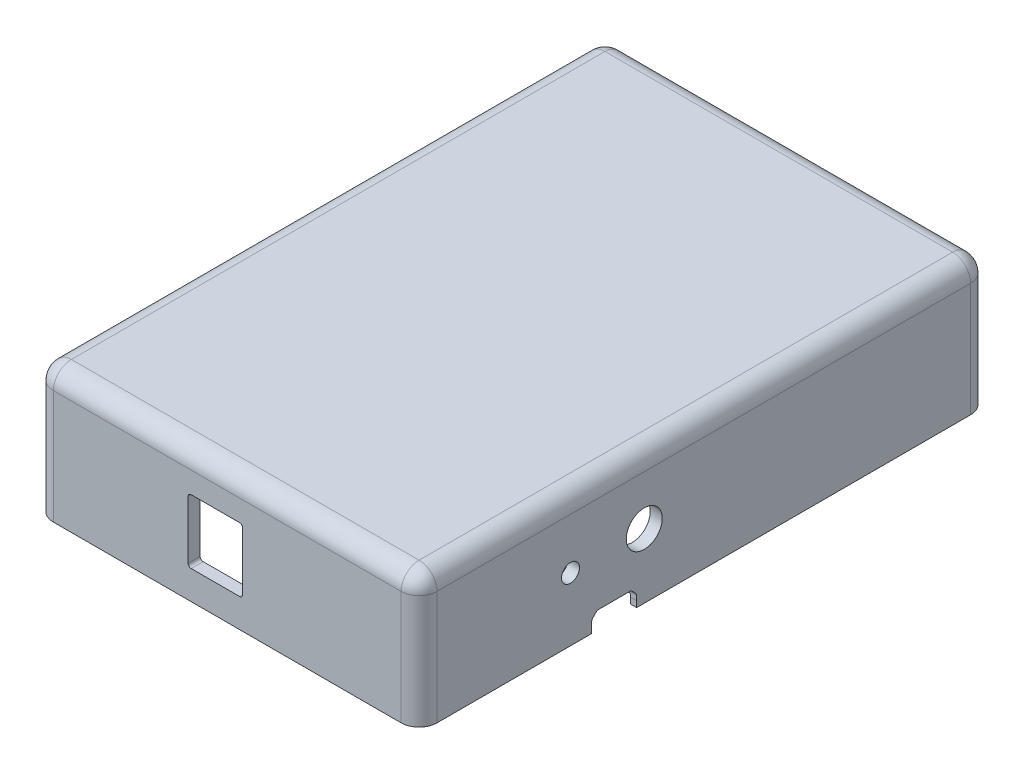
from build123d import *

# Parameters (mm, degrees)
SKETCH1_W            = 64
SKETCH1_H            = 95
BOSS_EXTRUDE1_DEPTH  = 2
BOSS_EXTRUDE2_DEPTH  = 20
CUT_EXTRUDE1_DEPTH   = 1.5
FILLET1_R            = 10
CUT_EXTRUDE5_REACH   = 104.22
SKETCH11_R           = 4
BOSS_EXTRUDE4_DEPTH  = 20
SKETCH15_W           = 35.50000000000001
SKETCH15_H           = 3.499999999999986
BOSS_EXTRUDE5_DEPTH  = 11
CUT_EXTRUDE6_DEPTH   = 9
CHAMFER4_SIZE        = 4.2
SKETCH18_R           = 4.999999999999999
SKETCH18_R_2         = 1.5000000000000009
BOSS_EXTRUDE6_DEPTH  = 18.5
FILLET2_R            = 3
FILLET3_R            = 3
SKETCH20_W           = 3.0000000000000036
SKETCH20_H           = 2.4299999999999855
SKETCH20_W_2         = 2.9999999999999964
SKETCH20_H_2         = 2.4299999999999926
BOSS_EXTRUDE7_DEPTH  = 18.5
FILLET6_R            = 1
FILLET7_R            = 2
SKETCH21_R           = 3.2500000000003135
SKETCH21_R_2         = 1.5000000000003137
BOSS_EXTRUDE8_DEPTH  = 3
LPATTERN1_COUNT      = 2
LPATTERN1_PITCH      = 52
SKETCH22_R           = 2.499999999999491
SKETCH22_R_2         = 0.9999999999994937
BOSS_EXTRUDE9_DEPTH  = 3
CUT_EXTRUDE11_DEPTH  = 7
LPATTERN3_COUNT      = 2
LPATTERN3_PITCH      = 41
CUT_EXTRUDE15_DEPTH  = 6.999999999999994
CUT_EXTRUDE16_DEPTH  = 2
SKETCH28_W           = 1.0000000000000036
SKETCH28_H           = 7.499999999999988
CUT_EXTRUDE17_DEPTH  = 1
SKETCH29_R           = 1.5000000000071216
CUT_EXTRUDE18_DEPTH  = 3
SKETCH30_R           = 3.0000000000000013
CUT_EXTRUDE19_DEPTH  = 3
CUT_EXTRUDE21_DEPTH  = 3
FILLET8_R            = 5
FILLET9_R            = 0.5
SKETCH34_R           = 1.500000000000316
BOSS_EXTRUDE10_DEPTH = 7
LPATTERN4_COUNT      = 2
LPATTERN4_PITCH      = 52
SKETCH35_R           = 0.9999999999994945
BOSS_EXTRUDE11_DEPTH = 5
LPATTERN5_COUNT      = 2
LPATTERN5_PITCH      = 41


with BuildPart() as part:
    # Sketch1 → Boss-Extrude1 (new body)
    with BuildSketch(Plane(origin=(0, 0, 0), x_dir=(1, 0, 0), z_dir=(0, 1, 0))):
        Rectangle(SKETCH1_W, SKETCH1_H)
    extrude(amount=BOSS_EXTRUDE1_DEPTH)

    # 3DSketch3 → Boss-Extrude2 (add)
    with BuildSketch(Plane(origin=(-29.999999999999986, 0, 45.49999999999999), x_dir=(0.554700196225229, 0, -0.8320502943378437), z_dir=(0, 1, 0))):
        Polygon((-2.7735009811261575, 0.5547001962252318), (76.27127698096902, 53.251218837622), (111.77208953938367, 0), (32.727311577288496, -52.69651864139676), align=None)
        Polygon((0, 0), (75.71657678474375, 50.47771785649584), (108.9985885582575, 0.554700196225201), (33.28201177351374, -49.923017660270624), align=None, mode=Mode.SUBTRACT)
    extrude(amount=-BOSS_EXTRUDE2_DEPTH)

    # Sketch2 → Cut-Extrude1 (cut)
    with BuildSketch(Plane.XZ.offset(20)):
        Polygon((31, 46.50000000000001), (-30.999999999999993, 46.50000000000001), (-30.999999999999993, -46.50000000000001), (31.000000000000007, -46.50000000000001), align=None)
    extrude(amount=-CUT_EXTRUDE1_DEPTH, mode=Mode.SUBTRACT)

    # Fillet1
    fillet1_edges = [part.edges().sort_by_distance(p)[0] for p in [
        (30.000000000000014, -9.25, -45.49999999999998),
        (-30, -9.25, -45.49999999999998),
        (30.000000000000007, -9.25, 45.5),
        (-29.999999999999986, -9.25, 45.49999999999999),
    ]]
    fillet(fillet1_edges, radius=FILLET1_R)

    # Sketch11 → Cut-Extrude5 (cut, up to next)
    with BuildSketch(Plane(origin=(0, 0, -47.5), x_dir=(-1, 0, 0), z_dir=(0, 0, -1)), mode=Mode.PRIVATE) as cut_extrude5_sk1:
        with Locations((-6.94e-15, -20)):
            Circle(SKETCH11_R)
    cut_extrude5_tool1 = extrude(cut_extrude5_sk1.sketch, amount=-CUT_EXTRUDE5_REACH, mode=Mode.PRIVATE) & part.part
    add(cut_extrude5_tool1.solids().sort_by_distance((0, -20, -47.5))[0], mode=Mode.SUBTRACT)

    # Sketch13 → Boss-Extrude4 (add)
    with BuildSketch(Plane.XZ):
        Polygon((15.250000000000018, -43.06999999999999), (-25.249999999999986, -43.07), (-25.249999999999986, -34.56999999999999), (15.250000000000018, -34.56999999999999), align=None)
        Polygon((12.750000000000016, -40.569999999999986), (12.750000000000016, -37.06999999999999), (-22.74999999999999, -37.07), (-22.74999999999999, -40.569999999999986), align=None, mode=Mode.SUBTRACT)
    extrude(amount=BOSS_EXTRUDE4_DEPTH)

    # Sketch15 → Boss-Extrude5 (add)
    with BuildSketch(Plane.XZ):
        with Locations((-4.999999999999987, -38.81999999999999)):
            Rectangle(SKETCH15_W, SKETCH15_H)
    extrude(amount=BOSS_EXTRUDE5_DEPTH)

    # Sketch17 → Cut-Extrude6 (cut)
    with BuildSketch(Plane.XY.offset(-34.56999999999999)):
        Polygon((4.7500000000000115, -20), (-15.24999999999999, -20.000000000000004), (-15.24999999999999, -15.5), (4.7500000000000115, -15.5), align=None)
    extrude(amount=-CUT_EXTRUDE6_DEPTH, mode=Mode.SUBTRACT)

    # Chamfer4
    chamfer4_edges = [part.edges().sort_by_distance(p)[0] for p in [
        (-15.249999999999984, -20.000000000000004, -35.81999999999999),
    ]]
    chamfer(chamfer4_edges, length=CHAMFER4_SIZE)

    # Sketch18 → Boss-Extrude6 (add)
    # profile 1 of 2: a face of its own
    with BuildSketch(Plane.XZ):
        with Locations((25.65752160816483, -41.15752160816483)):
            Circle(SKETCH18_R)
        with Locations(Location((25.65752160816483, -41.15752160816483, 0), (0, 0, 270))):
            Circle(SKETCH18_R_2, mode=Mode.SUBTRACT)
    # profile 2 of 2: a face of its own
    with BuildSketch(Plane.XZ):
        with Locations((-25.657521608164807, 41.15752160816483)):
            Circle(SKETCH18_R)
        with Locations(Location((-25.657521608164807, 41.15752160816483, 0), (0, 0, 270))):
            Circle(SKETCH18_R_2, mode=Mode.SUBTRACT)
    extrude(amount=BOSS_EXTRUDE6_DEPTH)

    # Fillet2
    fillet2_edges = [part.edges().sort_by_distance(p)[0] for p in [
        (32, -9, 47.5),
        (-31.999999999999993, -9, 47.5),
        (-31.999999999999993, -9, -47.500000000000014),
        (32.00000000000001, -9, -47.5),
    ]]
    fillet(fillet2_edges, radius=FILLET2_R)

    # Fillet3
    fillet3_edges = [part.edges().sort_by_distance(p)[0] for p in [
        (32.00000000000001, 2, 0),
        (1.421e-14, 2, 47.5),
        (7.11e-15, 2, -47.5),
        (-31.999999999999993, 2, 0),
        (31.121320343559645, 2.000000000000001, -46.62132034355964),
        (-31.121320343559635, 2.000000000000002, -46.621320343559645),
        (-31.121320343559635, 2, 46.621320343559645),
        (31.121320343559663, 1.9999999999999987, 46.621320343559645),
    ]]
    fillet(fillet3_edges, radius=FILLET3_R)

    # Sketch20 → Boss-Extrude7 (add)
    with BuildSketch(Plane.XZ):
        with Locations((11.500000000000018, -44.285)):
            Rectangle(SKETCH20_W, SKETCH20_H)
        with Locations((-18.749999999999986, -44.285)):
            Rectangle(SKETCH20_W_2, SKETCH20_H_2)
    extrude(amount=BOSS_EXTRUDE7_DEPTH)

    # Fillet6
    fillet6_edges = [part.edges().sort_by_distance(p)[0] for p in [
        (10.000000000000016, -9.25, -43.07),
        (13.000000000000018, -9.25, -43.07),
        (-20.249999999999982, -9.25, -43.07),
        (-17.249999999999986, -9.25, -43.07),
    ]]
    fillet(fillet6_edges, radius=FILLET6_R)

    # Fillet7
    # the kernel refuses this fillet: 2 mm, written as the material it adds along each edge
    with BuildSketch(Plane(origin=(15.250000000000018, 0, -34.56999999999999), x_dir=(1, 0, 0), z_dir=(0, 0, -1))) as fillet7_piece_1:
        with BuildLine():
            CenterArc((FILLET7_R, FILLET7_R), FILLET7_R, 180, 90)
            Line((0, FILLET7_R), (-FILLET7_R * 0.02, FILLET7_R))
            Line((-FILLET7_R * 0.02, FILLET7_R), (-FILLET7_R * 0.02, -FILLET7_R * 0.02))
            Line((-FILLET7_R * 0.02, -FILLET7_R * 0.02), (FILLET7_R, -FILLET7_R * 0.02))
            Line((FILLET7_R, -FILLET7_R * 0.02), (FILLET7_R, 0))
        make_face()
    extrude(amount=8.5)
    with BuildSketch(Plane(origin=(-25.249999999999986, 0, -34.56999999999999), x_dir=(0, 0, 1), z_dir=(1, 0, 0))) as fillet7_piece_2:
        with BuildLine():
            CenterArc((FILLET7_R, FILLET7_R), FILLET7_R, 180, 90)
            Line((0, FILLET7_R), (-FILLET7_R * 0.02, FILLET7_R))
            Line((-FILLET7_R * 0.02, FILLET7_R), (-FILLET7_R * 0.02, -FILLET7_R * 0.02))
            Line((-FILLET7_R * 0.02, -FILLET7_R * 0.02), (FILLET7_R, -FILLET7_R * 0.02))
            Line((FILLET7_R, -FILLET7_R * 0.02), (FILLET7_R, 0))
        make_face()
    extrude(amount=40.5)
    with BuildSketch(Plane(origin=(-25.249999999999986, 0, -43.07), x_dir=(-1, 0, 0), z_dir=(0, 0, 1))) as fillet7_piece_3:
        with BuildLine():
            CenterArc((FILLET7_R, FILLET7_R), FILLET7_R, 180, 90)
            Line((0, FILLET7_R), (-FILLET7_R * 0.02, FILLET7_R))
            Line((-FILLET7_R * 0.02, FILLET7_R), (-FILLET7_R * 0.02, -FILLET7_R * 0.02))
            Line((-FILLET7_R * 0.02, -FILLET7_R * 0.02), (FILLET7_R, -FILLET7_R * 0.02))
            Line((FILLET7_R, -FILLET7_R * 0.02), (FILLET7_R, 0))
        make_face()
    extrude(amount=8.500000000000007)
    with BuildSketch(Plane(origin=(-25.249999999999986, 0, -34.56999999999999), x_dir=(0, 0, 1), z_dir=(1, 0, 0))) as fillet7_piece_4a_section:
        with BuildLine():
            CenterArc((FILLET7_R, FILLET7_R), FILLET7_R, 180, 90)
            Line((0, FILLET7_R), (-FILLET7_R * 0.02, FILLET7_R))
            Line((-FILLET7_R * 0.02, FILLET7_R), (-FILLET7_R * 0.02, -FILLET7_R * 0.02))
            Line((-FILLET7_R * 0.02, -FILLET7_R * 0.02), (FILLET7_R, -FILLET7_R * 0.02))
            Line((FILLET7_R, -FILLET7_R * 0.02), (FILLET7_R, 0))
        make_face()
    fillet7_piece_4a = extrude(amount=45.50000000000001, mode=Mode.PRIVATE)
    fillet7_piece_4a = split(fillet7_piece_4a, bisect_by=Plane(origin=(15.250000000000018, -0.4527902285336496, -34.11720977146634), z_dir=(1, 0, 0)), keep=Keep.TOP, mode=Mode.PRIVATE)
    with BuildSketch(Plane(origin=(15.250000000000018, 0, -29.569999999999993), x_dir=(1, 0, 0), z_dir=(0, 0, -1))) as fillet7_piece_4b_section:
        with BuildLine():
            CenterArc((FILLET7_R, FILLET7_R), FILLET7_R, 180, 90)
            Line((0, FILLET7_R), (-FILLET7_R * 0.02, FILLET7_R))
            Line((-FILLET7_R * 0.02, FILLET7_R), (-FILLET7_R * 0.02, -FILLET7_R * 0.02))
            Line((-FILLET7_R * 0.02, -FILLET7_R * 0.02), (FILLET7_R, -FILLET7_R * 0.02))
            Line((FILLET7_R, -FILLET7_R * 0.02), (FILLET7_R, 0))
        make_face()
    fillet7_piece_4b = extrude(amount=13.5, mode=Mode.PRIVATE)
    fillet7_piece_4b = split(fillet7_piece_4b, bisect_by=Plane(origin=(15.702790228533665, -0.45279022853364864, -34.56999999999999), z_dir=(0, 0, 1)), keep=Keep.TOP, mode=Mode.PRIVATE)
    fillet7_piece_4 = fillet7_piece_4a & fillet7_piece_4b
    add(fillet7_piece_4)
    with BuildSketch(Plane(origin=(-25.249999999999986, 0, -43.07), x_dir=(-1, 0, 0), z_dir=(0, 0, 1))) as fillet7_piece_5a_section:
        with BuildLine():
            CenterArc((FILLET7_R, FILLET7_R), FILLET7_R, 180, 90)
            Line((0, FILLET7_R), (-FILLET7_R * 0.02, FILLET7_R))
            Line((-FILLET7_R * 0.02, FILLET7_R), (-FILLET7_R * 0.02, -FILLET7_R * 0.02))
            Line((-FILLET7_R * 0.02, -FILLET7_R * 0.02), (FILLET7_R, -FILLET7_R * 0.02))
            Line((FILLET7_R, -FILLET7_R * 0.02), (FILLET7_R, 0))
        make_face()
    fillet7_piece_5a = extrude(amount=13.500000000000007, mode=Mode.PRIVATE)
    fillet7_piece_5a = split(fillet7_piece_5a, bisect_by=Plane(origin=(-25.702790228533637, -0.4527902285336497, -34.56999999999999), z_dir=(0, 0, 1)), keep=Keep.TOP, mode=Mode.PRIVATE)
    with BuildSketch(Plane(origin=(-30.249999999999986, 0, -34.56999999999999), x_dir=(0, 0, 1), z_dir=(1, 0, 0))) as fillet7_piece_5b_section:
        with BuildLine():
            CenterArc((FILLET7_R, FILLET7_R), FILLET7_R, 180, 90)
            Line((0, FILLET7_R), (-FILLET7_R * 0.02, FILLET7_R))
            Line((-FILLET7_R * 0.02, FILLET7_R), (-FILLET7_R * 0.02, -FILLET7_R * 0.02))
            Line((-FILLET7_R * 0.02, -FILLET7_R * 0.02), (FILLET7_R, -FILLET7_R * 0.02))
            Line((FILLET7_R, -FILLET7_R * 0.02), (FILLET7_R, 0))
        make_face()
    fillet7_piece_5b = extrude(amount=45.5, mode=Mode.PRIVATE)
    fillet7_piece_5b = split(fillet7_piece_5b, bisect_by=Plane(origin=(-25.249999999999986, -0.4527902285336496, -34.11720977146634), z_dir=(-1, 0, 0)), keep=Keep.TOP, mode=Mode.PRIVATE)
    fillet7_piece_5 = fillet7_piece_5a & fillet7_piece_5b
    add(fillet7_piece_5)

    # Sketch21 → Boss-Extrude8 (add)
    with BuildSketch(Plane(origin=(0, 0, 0), x_dir=(-1, 0, 0), z_dir=(0, -1, 0))):
        with Locations(Location((-26.000005349460757, -0.9501322982906362, 0), (0, 0, 90))):
            Circle(SKETCH21_R)
        with Locations(Location((-26.000005349460757, -0.9501322982906362, 0), (0, 0, 90))):
            Circle(SKETCH21_R_2, mode=Mode.SUBTRACT)
    boss_extrude8 = extrude(amount=BOSS_EXTRUDE8_DEPTH)

    # LPattern1: Boss-Extrude8 ×2
    with Locations(*[(-i * LPATTERN1_PITCH, 0, 0) for i in range(1, LPATTERN1_COUNT)]):
        add(boss_extrude8)

    # Sketch22 → Boss-Extrude9 (add)
    with BuildSketch(Plane.XZ):
        with Locations(Location((20.50000678120127, 38.95013222508797, 0), (0, 0, 270))):
            Circle(SKETCH22_R)
        with Locations(Location((20.50000678120127, 38.95013222508797, 0), (0, 0, 270))):
            Circle(SKETCH22_R_2, mode=Mode.SUBTRACT)
    boss_extrude9 = extrude(amount=BOSS_EXTRUDE9_DEPTH)

    # Sketch23 → Cut-Extrude11 (cut)
    with BuildSketch(Plane.XZ):
        with BuildLine():
            ThreePointArc((-29.644985957222364, 38.14087975587361), (-22.121987702232076, 37.62198770223208), (-22.640879755873577, 45.144985957222374))
            ThreePointArc((-22.640879755873577, 45.144985957222374), (-27.59353074699804, 43.09353074699807), (-29.644985957222364, 38.14087975587361))
        make_face()
    extrude(amount=CUT_EXTRUDE11_DEPTH, mode=Mode.SUBTRACT)

    # LPattern3: Boss-Extrude9 ×2
    with Locations(*[(-i * LPATTERN3_PITCH, 0, 0) for i in range(1, LPATTERN3_COUNT)]):
        add(boss_extrude9)

    # Sketch26 → Cut-Extrude15 (cut)
    with BuildSketch(Plane.ZY.offset(31.999999999999993)):
        Polygon((-26.603788139112794, -6.177868543459395), (-12.603788139112794, -6.177868543459395), (-12.603788139112792, -15.377868543459394), (-26.603788139112794, -15.377868543459394), align=None)
    extrude(amount=-CUT_EXTRUDE15_DEPTH, mode=Mode.SUBTRACT)

    # Sketch27 → Cut-Extrude16 (cut)
    with BuildSketch(Plane(origin=(32.00000000000001, 0, 0), x_dir=(0, 0, -1), z_dir=(1, 0, 0))):
        with BuildLine():
            Line((-11.964783667405833, -17.251091270084597), (-11.36123027646374, -17.8546446611425))
            ThreePointArc((-11.36123027646374, -17.8546446611425), (-11.242005263259914, -18.033077503079873), (-11.200139006290035, -18.243553390968803))
            Line((-11.200139006290035, -18.243553390968803), (-11.20013900629005, -18.989999999968802))
            ThreePointArc((-11.20013900629005, -18.989999999968802), (-11.361529282000996, -19.37718465032421), (-11.750139006298053, -19.5351126616036))
            Line((-11.750139006298053, -19.5351126616036), (-18.150139006282053, -19.5351126616036))
            ThreePointArc((-18.150139006282053, -19.5351126616036), (-18.537323656637486, -19.375746799540167), (-18.700139006290055, -18.98999999996875))
            Line((-18.700139006290055, -18.98999999996875), (-18.700139006290055, -18.243553390968753))
            ThreePointArc((-18.700139006290055, -18.243553390968753), (-18.658272749392435, -18.033077503041074), (-18.539047736174236, -17.85464466108455))
            Line((-18.539047736174236, -17.85464466108455), (-17.935494345116336, -17.251091270142453))
            ThreePointArc((-17.935494345116336, -17.251091270142453), (-17.75706150313782, -17.131866257038), (-17.546585615290045, -17.089999999968878))
            Line((-17.546585615290045, -17.089999999968878), (-12.401915701790042, -17.08999999996888))
            ThreePointArc((-12.401915701790042, -17.08999999996888), (-12.165662519945602, -17.122550319939773), (-11.964783667405833, -17.251091270084597))
        make_face()
    extrude(amount=-CUT_EXTRUDE16_DEPTH, mode=Mode.SUBTRACT)

    # Sketch28 → Cut-Extrude17 (cut)
    with BuildSketch(Plane.XZ.offset(20)):
        with Locations((31.500000000000007, 14.950139006289877)):
            Rectangle(SKETCH28_W, SKETCH28_H)
    extrude(amount=-CUT_EXTRUDE17_DEPTH, mode=Mode.SUBTRACT)

    # Sketch29 → Cut-Extrude18 (cut)
    with BuildSketch(Plane(origin=(32.00000000000001, 0, 0), x_dir=(0, 0, -1), z_dir=(1, 0, 0))):
        with Locations((-22.250139006289977, -9.449999999968727)):
            Circle(SKETCH29_R)
    extrude(amount=-CUT_EXTRUDE18_DEPTH, mode=Mode.SUBTRACT)

    # Sketch30 → Cut-Extrude19 (cut)
    with BuildSketch(Plane(origin=(32.00000000000001, 0, 0), x_dir=(0, 0, -1), z_dir=(1, 0, 0))):
        with Locations((-9.938652432720547, -9.222983761630896)):
            Circle(SKETCH30_R)
    extrude(amount=-CUT_EXTRUDE19_DEPTH, mode=Mode.SUBTRACT)

    # Sketch32 → Cut-Extrude21 (cut)
    with BuildSketch(Plane.XY.offset(47.5)):
        with BuildLine():
            Line((2.0626708891022814, -15.213430951712692), (-6.022701275023219, -15.213430951712692))
            ThreePointArc((-6.022701275023219, -15.213430951712692), (-6.376254665616491, -15.066984342305966), (-6.522701275023218, -14.713430951712693))
            Line((-6.522701275023218, -14.713430951712693), (-6.522701275023218, -5.049999999968589))
            ThreePointArc((-6.522701275023218, -5.049999999968589), (-6.376254665616493, -4.6964466093753146), (-6.022701275023219, -4.5499999999685885))
            Line((-6.022701275023219, -4.5499999999685885), (2.0626708891022814, -4.549999999968588))
            ThreePointArc((2.0626708891022814, -4.549999999968588), (2.4162242796955553, -4.6964466093753146), (2.5626708891022814, -5.0499999999685885))
            Line((2.5626708891022814, -5.0499999999685885), (2.5626708891022814, -14.713430951712692))
            ThreePointArc((2.5626708891022814, -14.713430951712692), (2.4162242796955553, -15.066984342305965), (2.0626708891022814, -15.213430951712692))
        make_face()
    extrude(amount=-CUT_EXTRUDE21_DEPTH, mode=Mode.SUBTRACT)

    # Fillet8
    fillet8_edges = [part.edges().sort_by_distance(p)[0] for p in [
        (31, -19.25, 46.50000000000001),
        (31.000000000000007, -19.25, -46.50000000000001),
        (-30.999999999999993, -19.25, -46.50000000000001),
        (-30.999999999999993, -19.25, 46.50000000000001),
    ]]
    fillet(fillet8_edges, radius=FILLET8_R)

    # Fillet9
    # the kernel refuses this fillet: 0.5 mm, written as the material it takes off along each edge
    with BuildSketch(Plane(origin=(-25.657521608164803, -7, 41.15752160816483), x_dir=(-0.9221507108384667, 0, -0.386830798282803), z_dir=(-0.386830798282803, 0, 0.9221507108384667))) as fillet9_piece_1_section:
        with BuildLine():
            CenterArc((5.000000000000002 - FILLET9_R, FILLET9_R), FILLET9_R, 270, 90)
            Line((5.000000000000002 - FILLET9_R, 0), (5.000000000000002, 0))
            Line((5.000000000000002, 0), (5.000000000000002, FILLET9_R))
        make_face()
    fillet9_piece_1 = revolve(axis=Axis((-25.657521608164803, -7, 41.15752160816483), (0, -1, 0)), revolution_arc=224.48510883992174, mode=Mode.PRIVATE)
    fillet9_piece_1 = fillet9_piece_1 & Plane(origin=(-22.640879755873563, -7.065643538464356, 38.14087975587358), x_dir=(-2.03e-15, 0, 1), z_dir=(0, 1, 0)) * Cylinder(7.0041062013488, 21, mode=Mode.PRIVATE)
    add(fillet9_piece_1, mode=Mode.SUBTRACT)

    # Sketch34 → Boss-Extrude10 (add)
    with BuildSketch(Plane.XZ):
        with Locations(Location((-25.99999465053924, 0.9501322982906362, 0), (0, 0, 270))):
            Circle(SKETCH34_R)
    boss_extrude10 = extrude(amount=BOSS_EXTRUDE10_DEPTH)

    # LPattern4: Boss-Extrude10 ×2
    with Locations(*[(i * LPATTERN4_PITCH, 0, 0) for i in range(1, LPATTERN4_COUNT)]):
        add(boss_extrude10)

    # Sketch35 → Boss-Extrude11 (add)
    with BuildSketch(Plane.XZ):
        with Locations(Location((20.50000678120127, 38.95013222508797, 0), (0, 0, 270))):
            Circle(SKETCH35_R)
    boss_extrude11 = extrude(amount=BOSS_EXTRUDE11_DEPTH)

    # LPattern5: Boss-Extrude11 ×2
    with Locations(*[(-i * LPATTERN5_PITCH, 0, 0) for i in range(1, LPATTERN5_COUNT)]):
        add(boss_extrude11)


solid = part.part
